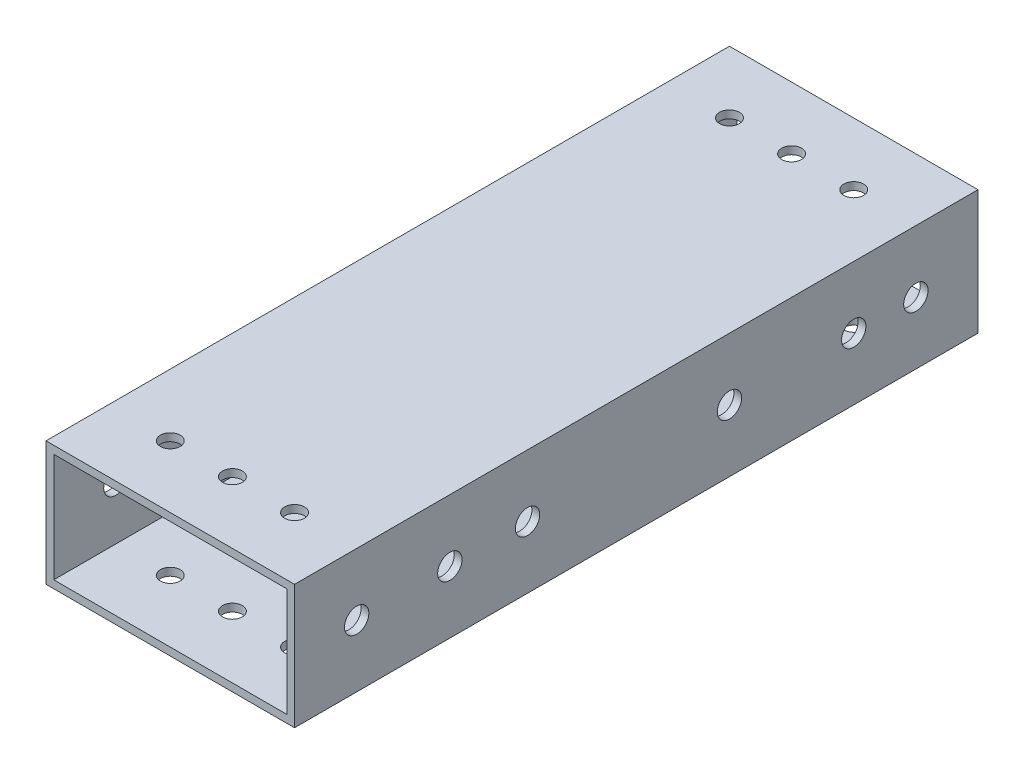
from build123d import *

# Parameters (mm, degrees)
SKETCH1_W           = 50.8
SKETCH1_H           = 25.4
SKETCH1_W_2         = 47.625
SKETCH1_H_2         = 22.225
BOSS_EXTRUDE1_DEPTH = 69.85
SKETCH2_R           = 2.0193
CUT_EXTRUDE1_DEPTH  = 79.545162168
SKETCH3_R           = 2.4892
CUT_EXTRUDE2_DEPTH  = 88.298066989


with BuildPart() as part:
    # Sketch1 → Boss-Extrude1 (new, symmetric)
    with BuildSketch(Plane.XY):
        Rectangle(SKETCH1_W, SKETCH1_H)
        Rectangle(SKETCH1_W_2, SKETCH1_H_2, mode=Mode.SUBTRACT)
    extrude(amount=BOSS_EXTRUDE1_DEPTH, both=True)

    # Sketch2 → Cut-Extrude1 (cut, through all)
    with BuildSketch(Plane(origin=(0, 12.7, 0), x_dir=(1, 0, 0), z_dir=(0, 1, 0))):
        with Locations((-12.7, 57.15)):
            Circle(SKETCH2_R)
        with Locations((0, 57.15)):
            Circle(SKETCH2_R)
        with Locations((12.7, 57.15)):
            Circle(SKETCH2_R)
        with Locations((12.7, -57.15)):
            Circle(SKETCH2_R)
        with Locations((0, -57.15)):
            Circle(SKETCH2_R)
        with Locations((-12.7, -57.15)):
            Circle(SKETCH2_R)
    extrude(amount=-CUT_EXTRUDE1_DEPTH, mode=Mode.SUBTRACT)

    # Sketch3 → Cut-Extrude2 (cut, through all)
    with BuildSketch(Plane(origin=(25.4, 0, 0), x_dir=(0, 0, -1), z_dir=(1, 0, 0))):
        with Locations((57.15, 0)):
            Circle(SKETCH3_R)
        with Locations((44.45, 0)):
            Circle(SKETCH3_R)
        with Locations((19.05, 0)):
            Circle(SKETCH3_R)
        with Locations((-57.15, 0)):
            Circle(SKETCH3_R)
        with Locations((-38.1, 0)):
            Circle(SKETCH3_R)
        with Locations((-22.225, 0)):
            Circle(SKETCH3_R)
    extrude(amount=-CUT_EXTRUDE2_DEPTH, mode=Mode.SUBTRACT)


solid = part.part
